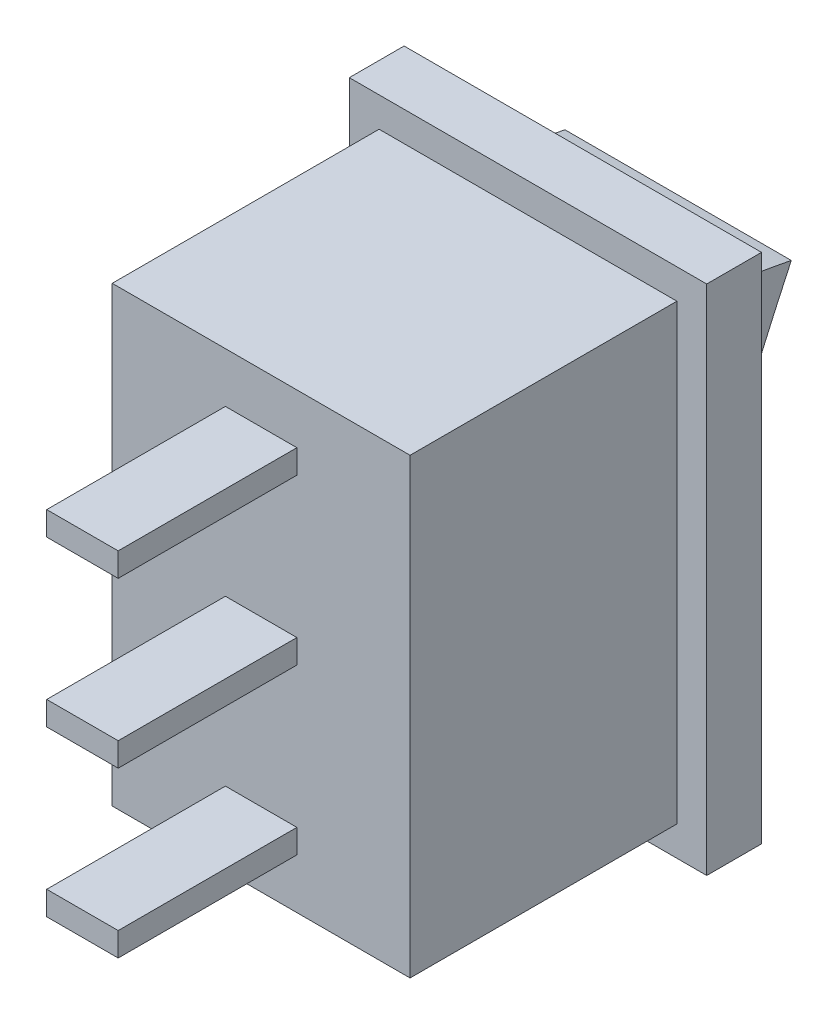
from build123d import *

# Parameters (mm, degrees)
SKETCH_1_W          = 15
SKETCH_1_H          = 21.5
EXTRUDE_1_DEPTH     = 2.3
SKETCH_2_W          = 12.5
SKETCH_2_H          = 19
EXTRUDE_2_DEPTH     = 11.2
SKETCH_3_W          = 9.5
SKETCH_3_H          = 15
EXTRUDE_3_DEPTH     = 4
CUT_EXTRUDE_START   = -9.5
CUT_EXTRUDE_1_DEPTH = 9.5
SKETCH_6_W          = 3
SKETCH_6_H          = 1
EXTRUDE_1_2_DEPTH   = 7.5


# Read off the part's stored shape, not the designer's step: 切除-拉伸1
with BuildPart() as part:
    # 草图1 → Extrude 1 (new body)
    with BuildSketch(Plane.XY):
        Rectangle(SKETCH_1_W, SKETCH_1_H)
    extrude(amount=EXTRUDE_1_DEPTH)

    # 草图2 → 拉伸2 (add)
    with BuildSketch(Plane.XY.offset(2.3)):
        Rectangle(SKETCH_2_W, SKETCH_2_H)
    extrude(amount=EXTRUDE_2_DEPTH)

    # 草图3 → 拉伸3 (add)
    with BuildSketch(Plane(origin=(0, 0, 0), x_dir=(-1, 0, 0), z_dir=(0, 0, -1))):
        Rectangle(SKETCH_3_W, SKETCH_3_H)
    extrude(amount=EXTRUDE_3_DEPTH)

    # 切除-拉伸1 outline → 切除-拉伸1 (cut)
    with BuildSketch(Plane.ZY.offset(4.75).offset(CUT_EXTRUDE_START)):
        with BuildLine():
            Line((-4, -7.5), (-0.355698538, -7.5))
            add(Edge.make_bspline(
                [(-0.355698538, -7.5), (-0.354349182, -7.203584733), (-0.342893084, -4.687006069), (-0.90591647, 0.423075599), (-2.923742076, 4.765110149), (-4, 7.081043238)],
                knots=[0, 0, 0, 0, 0.058645761, 0.497905094, 1, 1, 1, 1], degree=3))
            Line((-4, 7.081043238), (-4, -7.5))
        make_face()
        with BuildLine():
            Line((-4, 7.5), (-4, 7.081043238))
            add(Edge.make_bspline(
                [(-4, 7.081043238), (-3.418318642, 7.19501669), (-2.098267317, 7.453664838), (-0.752663012, 7.483379257), (0, 7.5)],
                knots=[0, 0, 0, 0, 0.440650562, 1, 1, 1, 1], degree=3))
            Line((0, 7.5), (-4, 7.5))
        make_face()
    extrude(amount=CUT_EXTRUDE_1_DEPTH, mode=Mode.SUBTRACT)

    # 草图6 → Extrude 1 2 (add)
    with BuildSketch(Plane.XY.offset(13.5)):
        Rectangle(SKETCH_6_W, SKETCH_6_H)
        with Locations((0, 6.9)):
            Rectangle(SKETCH_6_W, SKETCH_6_H)
        with Locations((0, -6.9)):
            Rectangle(SKETCH_6_W, SKETCH_6_H)
    extrude(amount=EXTRUDE_1_2_DEPTH)


solid = part.part
